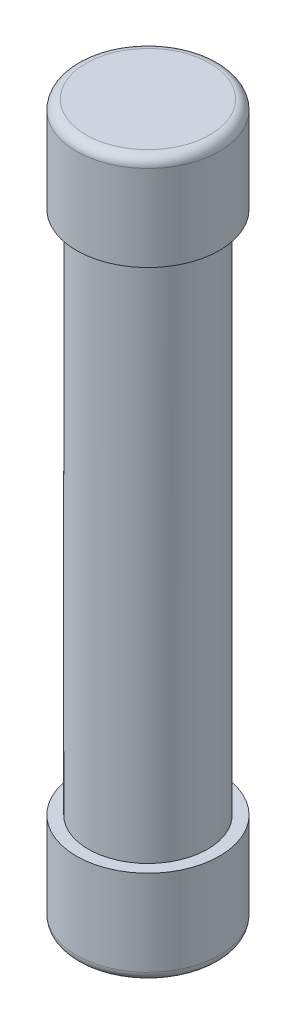
from build123d import *

# Parameters (mm, degrees)
SKETCH1_R           = 12.5
BOSS_EXTRUDE1_DEPTH = 75
SKETCH2_R           = 15
BOSS_EXTRUDE2_DEPTH = 20
FILLET1_R           = 2


# Read off the part's stored shape, not the designer's step: Shell2
with BuildPart() as part:
    # Sketch1 → Boss-Extrude1 (new, symmetric)
    with BuildSketch(Plane(origin=(0, 0, 0), x_dir=(1, 0, 0), z_dir=(0, 1, 0))):
        with Locations(Location((0, 0, 0), (0, 0, 270))):
            Circle(SKETCH1_R)
    extrude(amount=BOSS_EXTRUDE1_DEPTH, both=True)

    # Sketch2 → Boss-Extrude2 (add)
    with BuildSketch(Plane(origin=(0, 75, 0), x_dir=(1, 0, 0), z_dir=(0, 1, 0))):
        with Locations(Location((0, 0, 0), (0, 0, 270))):
            Circle(SKETCH2_R)
    boss_extrude2 = extrude(amount=-BOSS_EXTRUDE2_DEPTH)

    # Mirror1: Boss-Extrude2 across plane
    add(boss_extrude2.mirror(Plane.ZX))

    # Fillet1
    fillet1_edges = [part.edges().sort_by_distance(p)[0] for p in [
        (0, -75, -15),
        (0, 75, -15),
    ]]
    fillet(fillet1_edges, radius=FILLET1_R)

    # Shell2 outline → Shell2 (revolve, cut)
    with BuildSketch(Plane.XY):
        with BuildLine():
            Line((13, 74), (0, 74))
            Line((0, 74), (0, -74))
            Line((0, -74), (13, -74))
            ThreePointArc((13, -74), (13.707106781, -73.707106781), (14, -73))
            Line((14, -73), (14, -56))
            Line((14, -56), (11.5, -56))
            Line((11.5, -56), (11.5, 56))
            Line((11.5, 56), (14, 56))
            Line((14, 56), (14, 73))
            ThreePointArc((14, 73), (13.707106781, 73.707106781), (13, 74))
        make_face()
    revolve(axis=Axis((0, 0, 0), (0, 1, 0)), mode=Mode.SUBTRACT)


solid = part.part
